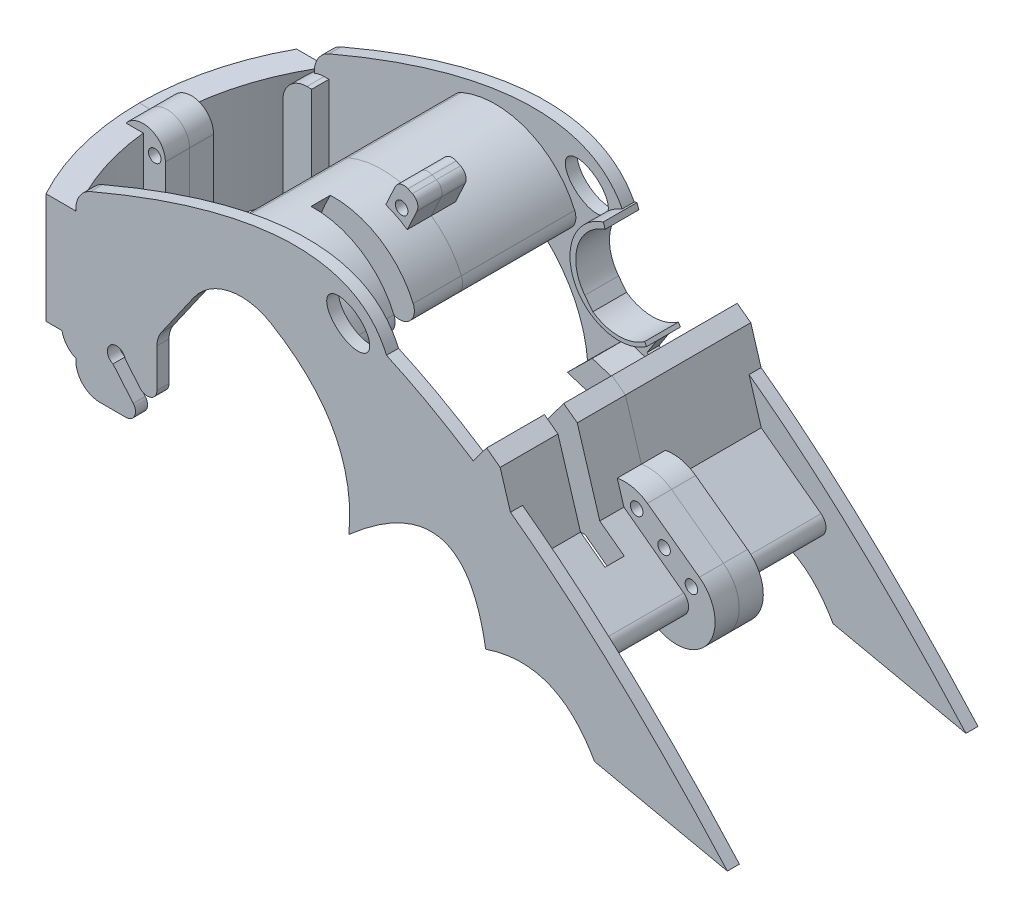
from build123d import *

# Parameters (mm, degrees)
BOSS_EXTRUDE1_DEPTH             = 3.175
FILLET1_R                       = 6.35
FILLET2_R                       = 15.24
FILLET3_R                       = 6.35
SKETCH2_W                       = 7.62
SKETCH2_H                       = 34.679504958
BOSS_EXTRUDE2_DEPTH             = 66.04
FILLET4_R                       = 2.54
FILLET1_OF_MIRROR2_R            = 6.35
FILLET2_OF_MIRROR2_R            = 15.24
FILLET3_OF_MIRROR2_R            = 6.35
FILLET4_OF_MIRROR2_R            = 2.54
FILLET5_START                   = -1
FILLET5_DEPTH                   = 68
FILLET5_START_2                 = 3.175
FILLET5_2_DEPTH                 = 59.69
BOSS_EXTRUDE3_DEPTH             = 66.04
BOSS_EXTRUDE6_DEPTH             = 29.11997
CUT_EXTRUDE1_DEPTH              = 38.1
BOSS_EXTRUDE7_REACH             = 121.491
BOSS_EXTRUDE7_DIRECTION_2_REACH = 121.491
CUT_EXTRUDE2_DEPTH              = 134.350127398
CUT_EXTRUDE3_DEPTH              = 2.54
CUT_EXTRUDE3_DEPTH_BACK         = 2.54
SKETCH13_R                      = 44.45
CUT_EXTRUDE9_DEPTH              = 68.58
BOSS_EXTRUDE8_START             = -8.89
BOSS_EXTRUDE8_DEPTH             = 8.89
TAP_DRILL_FOR_4_40_TAP1_D       = 2.2606
TAP_DRILL_FOR_4_40_TAP1_DEPTH   = 12.7
TAP_DRILL_FOR_4_40_TAP1_TIP     = 0.679152758
BOSS_EXTRUDE11_DEPTH            = 6.35
BOSS_EXTRUDE11_DEPTH_BACK       = 6.35
SKETCH21_R                      = 1.651
BOSS_EXTRUDE13_START            = -3.175
BOSS_EXTRUDE13_DEPTH            = 12.065
SKETCH24_W                      = 54.051780289
SKETCH24_H                      = 56.701712501
CUT_EXTRUDE10_DEPTH             = 36.83
SKETCH25_W                      = 87.81721295
SKETCH25_H                      = 98.960561551
CUT_EXTRUDE11_DEPTH             = 53.848


with BuildPart() as part:
    # Sketch1 → Boss-Extrude1 (new body)
    with BuildSketch(Plane.XY):
        with BuildLine():
            Line((50.815428811, -28.169433219), (85.837990546, -35.686780557))
            add(Edge.make_bspline(
                [(85.837990546, -35.686780557), (37.045439563, 18.631346841), (-3.996524698, 37.11343766)],
                knots=[0, 0, 0, 0.371923551, 0.371923551, 0.371923551], degree=2))
            add(Edge.make_bspline(
                [(-85.837990546, 33.806971222), (-15.708828484, 64.705105309), (-3.996524698, 37.11343766)],
                knots=[0, 0, 0, 0.406769717, 0.406769717, 0.406769717], degree=2))
            Line((-85.837990546, 33.806971222), (-85.837990546, -11.388692522))
            Line((-85.837990546, -11.388692522), (-67.205072008, -11.388692522))
            Line((-67.205072008, -11.388692522), (-76.043190553, -0.876800373))
            ThreePointArc((-76.043190553, -0.876800373), (-76.678128614, 3.141588203), (-72.828454816, 1.826063691))
            Line((-72.828454816, 1.826063691), (-64.461456133, -8.125487347))
            Line((-64.461456133, -8.125487347), (-64.461456133, 11.041010118))
            Line((-64.461456133, 11.041010118), (-47.440785313, 35.367440163))
            add(Edge.make_bspline(
                [(-47.440785313, 35.367440163), (-10.94231892, 21.565916132), (-13.89812039, -8.73455109)],
                knots=[0, 0, 0, 1, 1, 1], degree=2))
            add(Edge.make_bspline(
                [(-13.89812039, -8.73455109), (16.354395889, 17.832088288), (22.151507794, -16.88306006)],
                knots=[0, 0, 0, 1, 1, 1], degree=2))
            add(Edge.make_bspline(
                [(22.151507794, -16.88306006), (40.93348508, -10.477937426), (50.815428811, -28.169433219)],
                knots=[0, 0, 0, 1, 1, 1], degree=2))
        make_face()
        with BuildLine():
            add(Edge.make_bspline(
                [(-19.198064425, 43.338204841), (-23.364064259, 37.98191934), (-13.582830588, 34.672546948), (-3.801596916, 31.363174556), (-9.416830754, 40.028832449), (-15.032064591, 48.694490342), (-19.198064425, 43.338204841)],
                knots=[0, 0, 0, 2.094395102, 2.094395102, 4.188790205, 4.188790205, 6.283185307, 6.283185307, 6.283185307], degree=2, weights=[1, 0.5, 1, 0.5, 1, 0.5, 1]))
        make_face(mode=Mode.SUBTRACT)
    boss_extrude1 = extrude(amount=BOSS_EXTRUDE1_DEPTH)

    # Fillet1
    fillet1_edges = [part.edges().sort_by_distance(p)[0] for p in [
        (-64.461456133, 11.041010118, 1.5875),
        (-85.837990546, -11.388692522, 1.5875),
    ]]
    fillet(fillet1_edges, radius=FILLET1_R)

    # Fillet2
    fillet2_edges = [part.edges().sort_by_distance(p)[0] for p in [
        (-47.440785313, 35.367440163, 1.5875),
    ]]
    fillet(fillet2_edges, radius=FILLET2_R)

    # Fillet3
    fillet3_edges = [part.edges().sort_by_distance(p)[0] for p in [
        (-85.837990546, 33.806971222, 1.5875),
    ]]
    fillet(fillet3_edges, radius=FILLET3_R)

    # Sketch2 → Boss-Extrude2 (add)
    with BuildSketch(Plane(origin=(0, 0, 0), x_dir=(-1, 0, 0), z_dir=(0, 0, -1))):
        with Locations((85.837990546, 12.301059957)):
            Rectangle(SKETCH2_W, SKETCH2_H)
    extrude(amount=-BOSS_EXTRUDE2_DEPTH)

    # Fillet4
    fillet4_edges = [part.edges().sort_by_distance(p)[0] for p in [
        (-64.461456133, -8.125487347, 1.5875),
        (-67.205072008, -11.388692522, 1.5875),
    ]]
    fillet(fillet4_edges, radius=FILLET4_R)


with BuildPart() as mirror2_1:
    # Mirror2: Boss-Extrude1 across plane
    add(boss_extrude1.mirror(Plane.XY.offset(33.02)))

    # Fillet1 of Mirror2
    fillet1_of_mirror2_edges = [mirror2_1.edges().sort_by_distance(p)[0] for p in [
        (-64.461456133, 11.041010118, 64.4525),
        (-85.837990546, -11.388692522, 64.4525),
    ]]
    fillet(fillet1_of_mirror2_edges, radius=FILLET1_OF_MIRROR2_R)

    # Fillet2 of Mirror2
    fillet2_of_mirror2_edges = [mirror2_1.edges().sort_by_distance(p)[0] for p in [
        (-47.440785313, 35.367440163, 64.4525),
    ]]
    fillet(fillet2_of_mirror2_edges, radius=FILLET2_OF_MIRROR2_R)

    # Fillet3 of Mirror2
    fillet3_of_mirror2_edges = [mirror2_1.edges().sort_by_distance(p)[0] for p in [
        (-85.837990546, 33.806971222, 64.4525),
    ]]
    fillet(fillet3_of_mirror2_edges, radius=FILLET3_OF_MIRROR2_R)

    # Fillet4 of Mirror2
    fillet4_of_mirror2_edges = [mirror2_1.edges().sort_by_distance(p)[0] for p in [
        (-64.461456133, -8.125487347, 64.4525),
        (-67.205072008, -11.388692522, 64.4525),
    ]]
    fillet(fillet4_of_mirror2_edges, radius=FILLET4_OF_MIRROR2_R)


with BuildPart() as part_1:
    add(part.part)

    # Mirror2 united with what the copies touc: union Mirror2_1
    add(mirror2_1.part)

    # Fillet5: read off the stored shape, not the designer's step
    # Fillet5 outline → Fillet5 (cut)
    with BuildSketch(Plane.XY.offset(FILLET5_START)):
        with BuildLine():
            Line((-89.647990546, 29.640812436), (-89.647990546, 23.290812436))
            ThreePointArc((-89.647990546, 23.290812436), (-88.604384576, 26.778602912), (-85.816594514, 29.119974816))
            ThreePointArc((-85.816594514, 29.119974816), (-85.832639284, 29.380173981), (-85.837990547, 29.640812436))
            Line((-85.837990547, 29.640812436), (-89.647990546, 29.640812436))
        make_face()
        with BuildLine():
            ThreePointArc((-85.837990547, -5.038692522), (-85.832639284, -4.778054067), (-85.816594514, -4.517854902))
            ThreePointArc((-85.816594514, -4.517854902), (-88.604384576, -2.176482998), (-89.647990546, 1.311307478))
            Line((-89.647990546, 1.311307478), (-89.647990546, -5.038692522))
            Line((-89.647990546, -5.038692522), (-85.837990547, -5.038692522))
        make_face()
    extrude(amount=FILLET5_DEPTH, mode=Mode.SUBTRACT)

    # Fillet5 2 outline → Fillet5 2 (cut)
    with BuildSketch(Plane.XY.offset(FILLET5_START_2)):
        with BuildLine():
            Line((-85.837990547, -5.038692522), (-83.297990546, -5.038692522))
            ThreePointArc((-83.297990546, -5.038692522), (-84.583937451, -4.907120021), (-85.816594514, -4.517854902))
            ThreePointArc((-85.816594514, -4.517854902), (-85.832639284, -4.778054067), (-85.837990547, -5.038692522))
        make_face()
        with BuildLine():
            ThreePointArc((-85.837990547, 29.640812436), (-85.832639284, 29.380173981), (-85.816594514, 29.119974816))
            ThreePointArc((-85.816594514, 29.119974816), (-84.583937451, 29.509239935), (-83.297990546, 29.640812436))
            Line((-83.297990546, 29.640812436), (-85.837990547, 29.640812436))
        make_face()
    extrude(amount=FILLET5_2_DEPTH, mode=Mode.SUBTRACT)

    # Sketch3 → Boss-Extrude3 (add)
    with BuildSketch(Plane(origin=(0, 0, 0), x_dir=(-1, 0, 0), z_dir=(0, 0, -1))):
        with BuildLine():
            Line((-47.669690129, -4.623976608), (-18.554368983, 16.991943638))
            ThreePointArc((-18.554368983, 16.991943638), (-14.112511598, 16.335321241), (-14.769133994, 11.893463856))
            Line((-14.769133994, 11.893463856), (-43.88445514, -9.722456389))
            ThreePointArc((-43.88445514, -9.722456389), (-48.326312525, -9.065833993), (-47.669690129, -4.623976608))
        make_face()
        with BuildLine():
            ThreePointArc((47.115963717, 44.108959379), (29.70950774, 44.294419031), (17.270144905, 32.11733575))
            ThreePointArc((17.270144905, 32.11733575), (19.336090871, 26.975425789), (24.478000832, 29.041371755))
            ThreePointArc((24.478000832, 29.041371755), (32.631196544, 37.022660228), (44.039999723, 36.901103453))
            ThreePointArc((44.039999723, 36.901103453), (49.181909683, 38.967049419), (47.115963717, 44.108959379))
        make_face()
    extrude(amount=-BOSS_EXTRUDE3_DEPTH)

    # Sketch6 → Boss-Extrude6 (add)
    with BuildSketch(Plane(origin=(0, 0, 0), x_dir=(1, 0, 0), z_dir=(0, 1, 0))):
        with BuildLine():
            ThreePointArc((-92.696087431, 1.782134541), (-102.123445931, -33.02), (-92.696087431, -67.822134541))
            ThreePointArc((-92.696087431, -67.822134541), (-87.865856006, -69.088096884), (-86.599893662, -64.257865459))
            ThreePointArc((-86.599893662, -64.257865459), (-95.061746947, -33.02), (-86.599893662, -1.782134541))
            ThreePointArc((-86.599893662, -1.782134541), (-87.865856006, 3.048096884), (-92.696087431, 1.782134541))
        make_face()
    extrude(amount=BOSS_EXTRUDE6_DEPTH)

    # Sketch8 → Cut-Extrude1 (cut, symmetric)
    with BuildSketch(Plane(origin=(0, 29.119974816, 0), x_dir=(1, 0, 0), z_dir=(0, 1, 0))):
        with BuildLine():
            Line((-89.647990546, -7.70586622), (-71.756866477, -7.70586622))
            Line((-71.756866477, -7.70586622), (-71.756866477, -58.33413378))
            Line((-71.756866477, -58.33413378), (-89.647990546, -58.33413378))
            ThreePointArc((-89.647990546, -58.33413378), (-95.061746947, -33.02), (-89.647990546, -7.70586622))
        make_face()
    extrude(amount=CUT_EXTRUDE1_DEPTH, both=True, mode=Mode.SUBTRACT)

    # Boss-Extrude7: up to this face of the body (flat: up to its plane)
    boss_extrude7_end = Plane(part_1.part.faces().sort_by_distance((-11.295566277, 13.113197237, 0))[0])
    # Sketch11 → Boss-Extrude7 (add, up to the picked face)
    with BuildSketch(Plane.XY.offset(33.02), mode=Mode.PRIVATE) as boss_extrude7_sk1:
        Polygon((4.228068535, 4.692819394), (7.797004382, 2.043154901), (28.036897076, 2.043154901), (31.902152524, 7.082225554), (25.966132329, 26.515857851), (22.397196482, 29.165522343), align=None)
    boss_extrude7_tool1 = split(extrude(boss_extrude7_sk1.sketch, amount=-BOSS_EXTRUDE7_REACH, mode=Mode.PRIVATE), bisect_by=boss_extrude7_end, keep=Keep.BOTH, mode=Mode.PRIVATE)
    # Sketch11 → Boss-Extrude7 (add, up to the picked face)
    with BuildSketch(Plane.XY.offset(33.02), mode=Mode.PRIVATE) as boss_extrude7_sk2:
        Polygon((4.228068535, 4.692819394), (7.797004382, 2.043154901), (28.036897076, 2.043154901), (31.902152524, 7.082225554), (25.966132329, 26.515857851), (22.397196482, 29.165522343), align=None)
    boss_extrude7_tool2 = split(extrude(boss_extrude7_sk2.sketch, amount=-BOSS_EXTRUDE7_REACH, mode=Mode.PRIVATE), bisect_by=boss_extrude7_end, keep=Keep.BOTH, mode=Mode.PRIVATE)
    add(boss_extrude7_tool1.solids().sort_by(Axis((19.857226, 12.083632, 33.02), (0, 0, -1)))[0])
    add(boss_extrude7_tool2.solids().sort_by(Axis((19.857226, 12.083632, 33.02), (0, 0, -1)))[0])

    # Boss-Extrude7 direction 2: up to this face of the body (flat: up to its plane)
    boss_extrude7_direction_2_end = Plane(part_1.part.faces().sort_by_distance((-11.286383185, 13.143166696, 66.04))[0])
    # Sketch11 → Boss-Extrude7 direction 2 (add, up to the picked face)
    with BuildSketch(Plane.XY.offset(33.02), mode=Mode.PRIVATE) as boss_extrude7_direction_2_sk1:
        Polygon((4.228068535, 4.692819394), (7.797004382, 2.043154901), (28.036897076, 2.043154901), (31.902152524, 7.082225554), (25.966132329, 26.515857851), (22.397196482, 29.165522343), align=None)
    boss_extrude7_direction_2_tool1 = split(extrude(boss_extrude7_direction_2_sk1.sketch, amount=BOSS_EXTRUDE7_DIRECTION_2_REACH, mode=Mode.PRIVATE), bisect_by=boss_extrude7_direction_2_end, keep=Keep.BOTH, mode=Mode.PRIVATE)
    # Sketch11 → Boss-Extrude7 direction 2 (add, up to the picked face)
    with BuildSketch(Plane.XY.offset(33.02), mode=Mode.PRIVATE) as boss_extrude7_direction_2_sk2:
        Polygon((4.228068535, 4.692819394), (7.797004382, 2.043154901), (28.036897076, 2.043154901), (31.902152524, 7.082225554), (25.966132329, 26.515857851), (22.397196482, 29.165522343), align=None)
    boss_extrude7_direction_2_tool2 = split(extrude(boss_extrude7_direction_2_sk2.sketch, amount=BOSS_EXTRUDE7_DIRECTION_2_REACH, mode=Mode.PRIVATE), bisect_by=boss_extrude7_direction_2_end, keep=Keep.BOTH, mode=Mode.PRIVATE)
    add(boss_extrude7_direction_2_tool1.solids().sort_by(Axis((19.857226, 12.083632, 33.02), (0, 0, 1)))[0])
    add(boss_extrude7_direction_2_tool2.solids().sort_by(Axis((19.857226, 12.083632, 33.02), (0, 0, 1)))[0])

    # Sketch12 → Cut-Extrude2 (cut, through all)
    with BuildSketch(Plane(origin=(0, 0, 0), x_dir=(-1, 0, 0), z_dir=(0, 0, -1))):
        with BuildLine():
            Line((-22.151507791, -16.883060061), (13.898120382, -8.734551012))
            add(Edge.make_bspline(
                [(-22.151507791, -16.883060061), (-16.354395874, 17.832088283), (13.898120382, -8.734551012)],
                knots=[0, 0, 0, 1, 1, 1], degree=2))
        make_face()
    extrude(amount=-CUT_EXTRUDE2_DEPTH, mode=Mode.SUBTRACT)

    # Sketch13 → Cut-Extrude3 (cut, two sides: drawn at the far end of the back side and taken through both)
    with BuildSketch(Plane.XY.offset(48.26).offset(-CUT_EXTRUDE3_DEPTH_BACK)):
        with Locations((0, 24.776055506)):
            Circle(SKETCH13_R)
    extrude(amount=CUT_EXTRUDE3_DEPTH + CUT_EXTRUDE3_DEPTH_BACK, mode=Mode.SUBTRACT)

    # Sketch14 → Cut-Extrude9 (cut)
    with BuildSketch(Plane.XY.offset(48.26)):
        with BuildLine():
            Line((5.810011209, 6.823599323), (20.637431474, 26.795226617))
            Line((20.637431474, 26.795226617), (9.876821764, 33.379167325))
            ThreePointArc((9.876821764, 33.379167325), (-11.583096743, 28.921505998), (6.866892928, 17.089484702))
            Line((6.866892928, 17.089484702), (1.811013407, 9.214980442))
            Line((1.811013407, 9.214980442), (5.810011209, 6.823599323))
        make_face()
    extrude(amount=-CUT_EXTRUDE9_DEPTH, mode=Mode.SUBTRACT)

    # Sketch18 → Boss-Extrude8 (add)
    with BuildSketch(Plane(origin=(0, 0, 0), x_dir=(-1, 0, 0), z_dir=(0, 0, -1)).offset(BOSS_EXTRUDE8_START)):
        with BuildLine():
            Line((-7.451453183, 16.258494144), (-6.866892928, 17.089484702))
            ThreePointArc((-6.866892928, 17.089484702), (-0.056585078, 14.934067461), (6.753722773, 17.089484702))
            Line((6.753722773, 17.089484702), (8.867074761, 19.791665522))
            ThreePointArc((8.867074761, 19.791665522), (10.789737503, 30.041417245), (3.521317618, 37.519660004))
            Line((3.521317618, 37.519660004), (4.002636462, 38.965657296))
            ThreePointArc((4.002636462, 38.965657296), (11.41884298, 20.982274451), (-7.451453183, 16.258494144))
        make_face()
    extrude(amount=BOSS_EXTRUDE8_DEPTH)

    # Tap Drill for #4-40 Tap1
    with Locations(Plane(origin=(-23.464802224, -32.607782036, 33.02), x_dir=(0, 0, 1), z_dir=(-0.8029102017458029, 0.596099998265823, 0))):
        with Locations((-3.2258, 61.696753631), (-9.535953058, 60.87930493), (-15.894972606, 60.87930493), (-22.2758, 61.696753631), (-28.613011702, 60.87930493)):
            Hole(TAP_DRILL_FOR_4_40_TAP1_D / 2, depth=TAP_DRILL_FOR_4_40_TAP1_DEPTH)
            with Locations((0, 0, -(TAP_DRILL_FOR_4_40_TAP1_DEPTH + TAP_DRILL_FOR_4_40_TAP1_TIP / 2))):  # 118° drill point
                Cone(0, TAP_DRILL_FOR_4_40_TAP1_D / 2, TAP_DRILL_FOR_4_40_TAP1_TIP, mode=Mode.SUBTRACT)

    # Sketch21 → Boss-Extrude11 (add, two sides: drawn at the far end of the back side and taken through both)
    # profile 1 of 3: a face of its own
    with BuildSketch(Plane.XY.offset(33.02).offset(-BOSS_EXTRUDE11_DEPTH_BACK)):
        with BuildLine():
            Line((-36.515356143, 32.529535317), (-28.374584185, 50.043368597))
            ThreePointArc((-28.374584185, 50.043368597), (-26.942900926, 51.358489438), (-25.000617121, 51.276067362))
            Line((-25.000617121, 51.276067362), (-23.848950663, 50.740750287))
            ThreePointArc((-23.848950663, 50.740750287), (-22.533829822, 49.309067028), (-22.616251898, 47.366783223))
            Line((-22.616251898, 47.366783223), (-30.757023856, 29.852949942))
            ThreePointArc((-30.757023856, 29.852949942), (-32.188707115, 28.537829101), (-34.130990921, 28.620251177))
            Line((-34.130990921, 28.620251177), (-35.282657378, 29.155568252))
            ThreePointArc((-35.282657378, 29.155568252), (-36.597778219, 30.587251511), (-36.515356143, 32.529535317))
        make_face()
        with Locations((-26.654145897, 46.077396976)):
            Circle(SKETCH21_R, mode=Mode.SUBTRACT)
        with Locations((-33.092588576, 32.485129098)):
            Circle(SKETCH21_R, mode=Mode.SUBTRACT)
    # profile 2 of 3: a face of its own
    with BuildSketch(Plane.XY.offset(33.02).offset(-BOSS_EXTRUDE11_DEPTH_BACK)):
        with BuildLine():
            Line((39.772408112, -15.368922933), (26.096430539, -5.34908413))
            ThreePointArc((26.096430539, -5.34908413), (23.905388627, 8.851286828), (38.105759585, 11.042328739))
            Line((38.105759585, 11.042328739), (51.781737158, 1.022489937))
            ThreePointArc((51.781737158, 1.022489937), (53.97277907, -13.177881021), (39.772408112, -15.368922933))
        make_face()
        with Locations((49.693867933, -2.170968241)):
            Circle(SKETCH21_R, mode=Mode.SUBTRACT)
        with Locations((42.48406636, 3.111363437)):
            Circle(SKETCH21_R, mode=Mode.SUBTRACT)
        with Locations((35.274264788, 8.393695114)):
            Circle(SKETCH21_R, mode=Mode.SUBTRACT)
        with Locations((42.188037279, -12.415601284)):
            Circle(SKETCH21_R, mode=Mode.SUBTRACT)
        with Locations((27.768434134, -1.850937929)):
            Circle(SKETCH21_R, mode=Mode.SUBTRACT)
        with Locations((34.978235706, -7.133269607)):
            Circle(SKETCH21_R, mode=Mode.SUBTRACT)
    # profile 3 of 3: a face of its own
    with BuildSketch(Plane.XY.offset(33.02).offset(-BOSS_EXTRUDE11_DEPTH_BACK)):
        with BuildLine():
            Line((-100.623003581, 25.433781641), (-100.623003581, 3.111363437))
            ThreePointArc((-100.623003581, 3.111363437), (-94.770152593, -2.741487551), (-88.917301605, 3.111363437))
            Line((-88.917301605, 3.111363437), (-88.917301605, 25.433781641))
            ThreePointArc((-88.917301605, 25.433781641), (-94.770152593, 31.286632629), (-100.623003581, 25.433781641))
        make_face()
        with Locations((-91.716491208, 3.111363437)):
            Circle(SKETCH21_R, mode=Mode.SUBTRACT)
        with Locations((-91.716491208, 14.287363437)):
            Circle(SKETCH21_R, mode=Mode.SUBTRACT)
        with Locations((-91.716491208, 25.463363437)):
            Circle(SKETCH21_R, mode=Mode.SUBTRACT)
    extrude(amount=BOSS_EXTRUDE11_DEPTH + BOSS_EXTRUDE11_DEPTH_BACK)

    # Sketch23 → Boss-Extrude13 (add)
    with BuildSketch(Plane.XY.offset(3.175).offset(BOSS_EXTRUDE13_START)):
        Polygon((21.533809675, -6.867236868), (-10.305260333, 3.08247251), (-3.744387538, 9.540831668), (19.897227044, 2.043154901), align=None)
    extrude(amount=BOSS_EXTRUDE13_DEPTH)

    # Sketch24 → Cut-Extrude10 (cut)
    with BuildSketch(Plane(origin=(0, 0, 0), x_dir=(-1, 0, 0), z_dir=(0, 0, -1))):
        with Locations((86.117141055, 14.490353072)):
            Rectangle(SKETCH24_W, SKETCH24_H)
    extrude(amount=CUT_EXTRUDE10_DEPTH, mode=Mode.SUBTRACT)

    # Sketch25 → Cut-Extrude11 (cut)
    with BuildSketch(Plane.XY.offset(66.04)):
        with Locations((-86.117141054, 14.490353073)):
            Rectangle(SKETCH25_W, SKETCH25_H)
    extrude(amount=CUT_EXTRUDE11_DEPTH, mode=Mode.SUBTRACT)


with BuildPart() as body_2:
    # Split2: the piece on the far side of the plane
    add(part_1.part)
    split(bisect_by=Plane.XY.offset(33.02), keep=Keep.BOTTOM)


with BuildPart() as part_2:
    add(part_1.part)

    # Split2
    split(bisect_by=Plane.XY.offset(33.02), keep=Keep.TOP)


solid = Compound([body_2.part, part_2.part])
